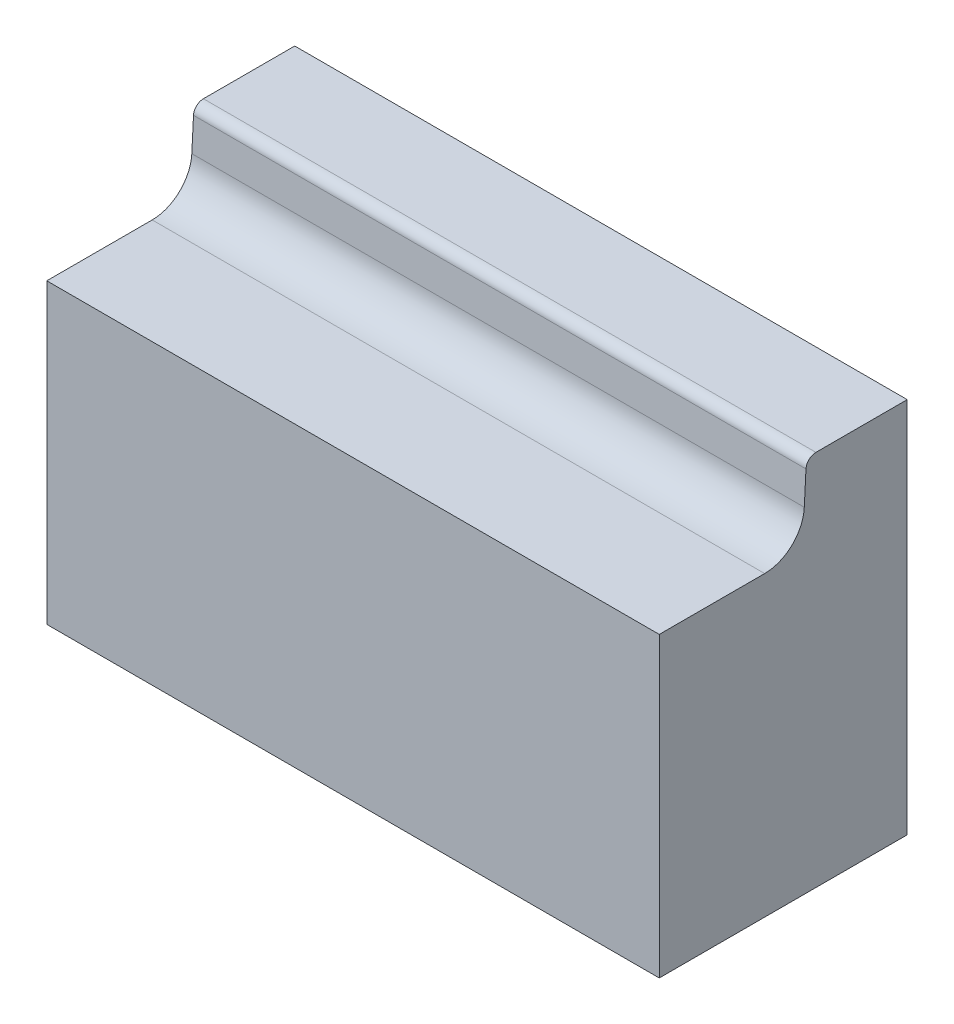
from build123d import *

# Parameters (mm, degrees)
SKETCH1_W           = 61.75
SKETCH1_H           = 38
BOSS_EXTRUDE1_DEPTH = 12.5
CUT_EXTRUDE1_REACH  = 75.575
FILLET1_R           = 1


with BuildPart() as part:
    # Sketch1 → Boss-Extrude1 (new, symmetric)
    with BuildSketch(Plane.XY):
        with Locations((36.981465557, -19)):
            Rectangle(SKETCH1_W, SKETCH1_H)
    extrude(amount=BOSS_EXTRUDE1_DEPTH, both=True)

    # Sketch2 → Cut-Extrude1 (cut, up to next)
    with BuildSketch(Plane(origin=(67.856465557, 0, 0), x_dir=(0, 0, -1), z_dir=(1, 0, 0)), mode=Mode.PRIVATE) as cut_extrude1_sk1:
        with BuildLine():
            Line((2.342754418, 0), (2.122152056, -4.209343825))
            ThreePointArc((2.122152056, -4.209343825), (0.88105222, -6.901497484), (-1.872366083, -8))
            Line((-1.872366083, -8), (-12.5, -8))
            Line((-12.5, -8), (-12.5, 0))
            Line((-12.5, 0), (2.342754418, 0))
        make_face()
    cut_extrude1_tool1 = extrude(cut_extrude1_sk1.sketch, amount=-CUT_EXTRUDE1_REACH, mode=Mode.PRIVATE) & part.part
    add(cut_extrude1_tool1.solids().sort_by_distance((67.856466, -3.896267, 5.35091))[0], mode=Mode.SUBTRACT)

    # Fillet1
    fillet1_edges = [part.edges().sort_by_distance(p)[0] for p in [
        (36.981465557, 0, -2.342754418),
    ]]
    fillet(fillet1_edges, radius=FILLET1_R)


solid = part.part
